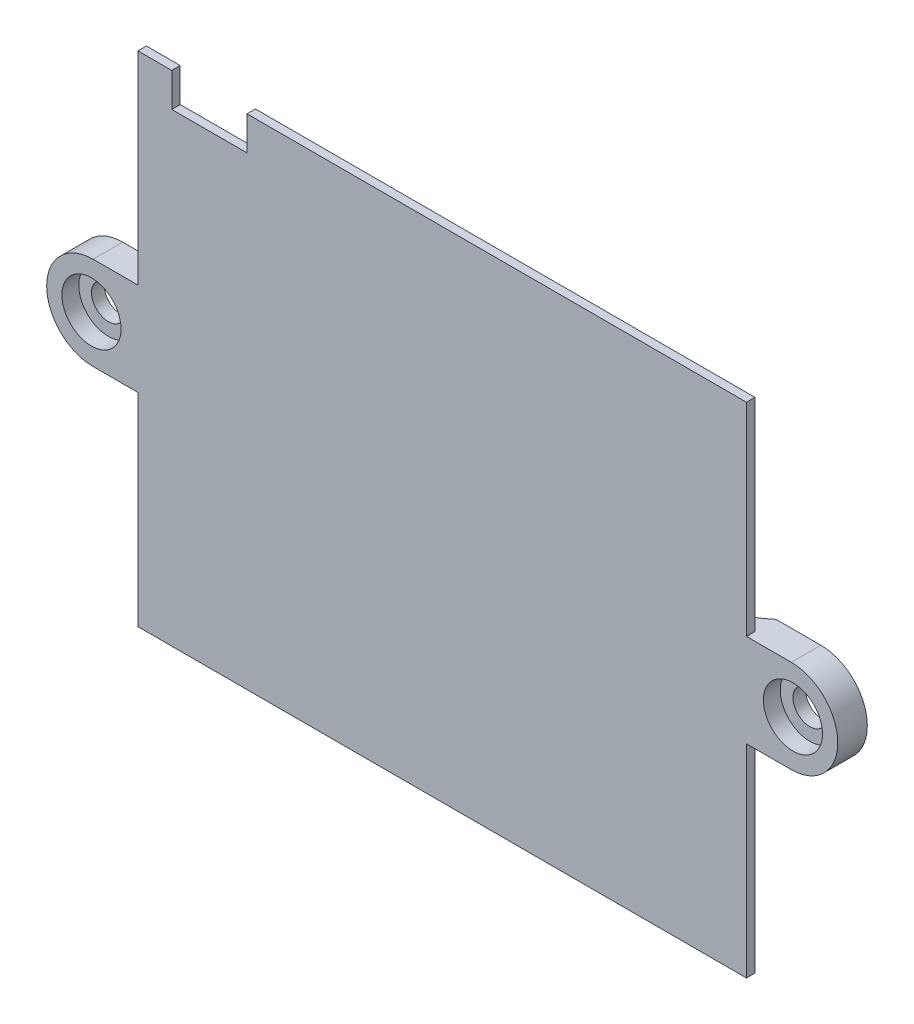
from build123d import *

# Parameters (mm, degrees)
BOSS_EXTRUDE1_START = 3
BOSS_EXTRUDE1_DEPTH = 1
BOSS_EXTRUDE2_START = 0.5
SKETCH1_3_R         = 2
BOSS_EXTRUDE2_DEPTH = 3.5
FILLET1_R           = 10
SKETCH2_R           = 3.5
CUT_EXTRUDE1_DEPTH  = 2


with BuildPart() as part:
    # Sketch1 → Boss-Extrude1 (new body)
    with BuildSketch(Plane.XY.offset(BOSS_EXTRUDE1_START)):
        Polygon((-103.211042913, -22.2), (-31.211042913, -22.2), (-31.211042913, 36.8), (-90.311042913, 36.8), (-90.311042913, 32.8), (-99.211042913, 32.8), (-99.211042913, 36.8), (-103.211042913, 36.8), align=None)
    extrude(amount=BOSS_EXTRUDE1_DEPTH)

    # Sketch1<3> → Boss-Extrude2 (add)
    # profile 1 of 2: a face of its own
    with BuildSketch(Plane.XY.offset(BOSS_EXTRUDE2_START)):
        with BuildLine():
            Line((-108.511042913, 1.8), (-103.211042913, 1.8))
            Line((-103.211042913, 1.8), (-103.211042913, 12.8))
            Line((-103.211042913, 12.8), (-108.511042913, 12.8))
            ThreePointArc((-108.511042913, 12.8), (-114.011042913, 7.3), (-108.511042913, 1.8))
        make_face()
        with Locations((-108.711042913, 7.3)):
            Circle(SKETCH1_3_R, mode=Mode.SUBTRACT)
    # profile 2 of 2: a face of its own
    with BuildSketch(Plane.XY.offset(BOSS_EXTRUDE2_START)):
        with BuildLine():
            Line((-31.211042913, 12.8), (-31.211042913, 1.8))
            Line((-31.211042913, 1.8), (-25.911042913, 1.8))
            ThreePointArc((-25.911042913, 1.8), (-20.411042913, 7.3), (-25.911042913, 12.8))
            Line((-25.911042913, 12.8), (-31.211042913, 12.8))
        make_face()
        with Locations((-25.711042913, 7.3)):
            Circle(SKETCH1_3_R, mode=Mode.SUBTRACT)
    extrude(amount=BOSS_EXTRUDE2_DEPTH)

    # Fillet1
    # the kernel refuses this fillet: 10 mm, written as the material it adds along each edge
    with BuildSketch(Plane(origin=(-31.211042913, 1.8, 3), x_dir=(-1, 0, 0), z_dir=(0, 1, 0)), Plane(origin=(-103.211042913, 12.8, 3), x_dir=(1, 0, 0), z_dir=(0, -1, 0))) as fillet1_piece_1:
        with BuildLine():
            CenterArc((6.614378278, -10), FILLET1_R, 90, 41.409622109)
            Line((0, -2.5), (0, 0))
            Line((0, 0), (6.614378278, 0))
        make_face()
    extrude(amount=11)

    # Sketch2 → Cut-Extrude1 (cut)
    with BuildSketch(Plane.XY.offset(4)):
        with Locations((-108.711042913, 7.3)):
            Circle(SKETCH2_R)
        with Locations((-25.711042913, 7.3)):
            Circle(SKETCH2_R)
    extrude(amount=-CUT_EXTRUDE1_DEPTH, mode=Mode.SUBTRACT)


solid = part.part
